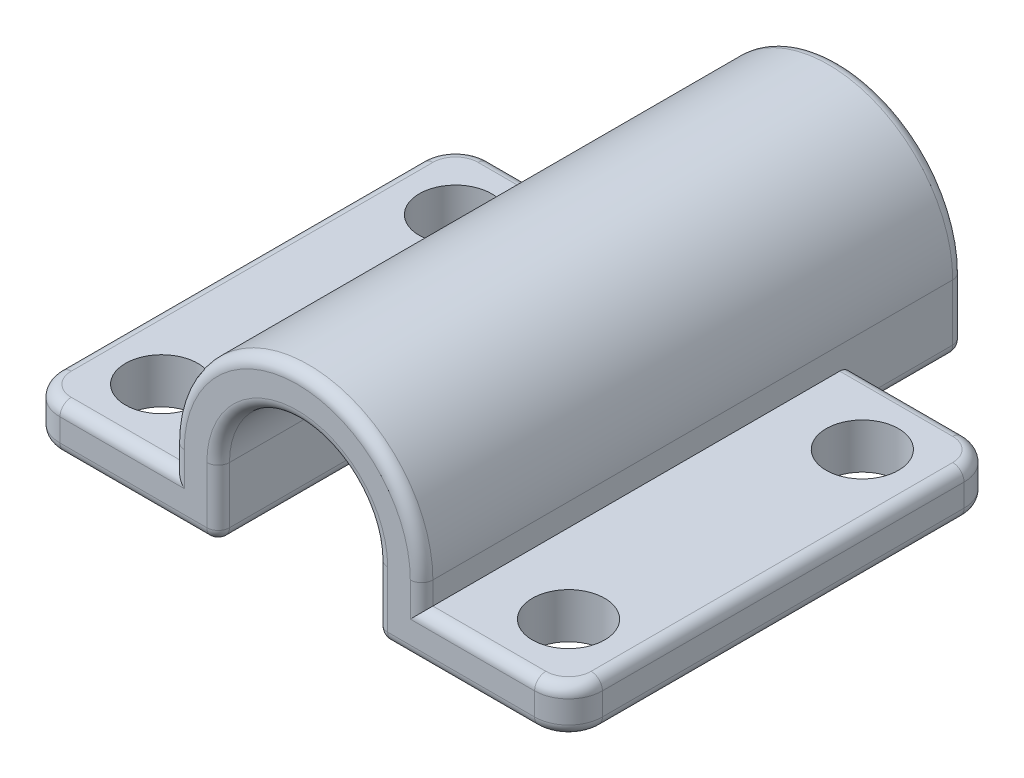
from build123d import *
from build123d.topology import SkipClean

# Parameters (mm, degrees)
BOSS_EXTRUDE1_DEPTH  = 19
M3_CLEARANCE_HOLE1_D = 3.2
BOSS_EXTRUDE2_START  = 5
BOSS_EXTRUDE2_DEPTH  = 5
M3_CLEARANCE_HOLE2_D = 3.2
FILLET1_R            = 1.5
FILLET2_R            = 0.5


with BuildPart() as part:
    # Sketch1 → Boss-Extrude1 (new body)
    with BuildSketch(Plane.XY):
        with BuildLine():
            ThreePointArc((-5.5, 0), (-5.477033779, -0.502096593), (-5.408326913, -1))
            Line((-5.408326913, -1), (-3.5, -1))
            Line((-3.5, -1), (-3.5, 0))
            ThreePointArc((-3.5, 0), (0, 3.5), (3.5, 0))
            Line((3.5, 0), (3.5, -1))
            Line((3.5, -1), (5.408326913, -1))
            ThreePointArc((5.408326913, -1), (5.477033779, -0.502096593), (5.5, 0))
            ThreePointArc((5.5, 0), (0, 5.5), (-5.5, 0))
        make_face()
        with BuildLine():
            Line((5.5, -1), (5.5, 0))
            ThreePointArc((5.5, 0), (5.477033779, -0.502096593), (5.408326913, -1))
            Line((5.408326913, -1), (5.5, -1))
        make_face()
        with BuildLine():
            Line((-5.5, 0), (-5.5, -1))
            Line((-5.5, -1), (-5.408326913, -1))
            ThreePointArc((-5.408326913, -1), (-5.477033779, -0.502096593), (-5.5, 0))
        make_face()
        with BuildLine():
            Line((-5.5, -1), (-12, -1))
            Line((-12, -1), (-12, -3))
            Line((-12, -3), (-4.609772229, -3))
            ThreePointArc((-4.609772229, -3), (-5.107893656, -2.039466204), (-5.408326913, -1))
            Line((-5.408326913, -1), (-5.5, -1))
        make_face()
        with BuildLine():
            Line((-3.5, -1), (-5.408326913, -1))
            ThreePointArc((-5.408326913, -1), (-5.107893656, -2.039466204), (-4.609772229, -3))
            Line((-4.609772229, -3), (-3.5, -3))
            Line((-3.5, -3), (-3.5, -1))
        make_face()
        with BuildLine():
            Line((3.5, -3), (4.609772229, -3))
            ThreePointArc((4.609772229, -3), (5.107893656, -2.039466204), (5.408326913, -1))
            Line((5.408326913, -1), (3.5, -1))
            Line((3.5, -1), (3.5, -3))
        make_face()
        with BuildLine():
            ThreePointArc((5.408326913, -1), (5.107893656, -2.039466204), (4.609772229, -3))
            Line((4.609772229, -3), (12, -3))
            Line((12, -3), (12, -1))
            Line((12, -1), (5.5, -1))
            Line((5.5, -1), (5.408326913, -1))
        make_face()
    extrude(amount=BOSS_EXTRUDE1_DEPTH)

    # M3 Clearance Hole1 (through all)
    with Locations(Plane(origin=(0, -1, 0), x_dir=(1, 0, 0), z_dir=(0, 1, 0))):
        with Locations((9, -3), (-9, -3)):
            Hole(M3_CLEARANCE_HOLE1_D / 2)

    # Sketch5 → Boss-Extrude2 (add)
    with SkipClean():  # the faces are left unmerged after this step: merging them gives an invalid solid
        with BuildSketch(Plane(origin=(0, 0, 0), x_dir=(-1, 0, 0), z_dir=(0, 0, -1)).offset(BOSS_EXTRUDE2_START)):
            with BuildLine():
                Line((-5.5, 0), (-5.5, -1))
                Line((-5.5, -1), (-5.5, -3))
                Line((-5.5, -3), (-3.5, -3))
                Line((-3.5, -3), (-3.5, 0))
                ThreePointArc((-3.5, 0), (0, 3.5), (3.5, 0))
                Line((3.5, 0), (3.5, -3))
                Line((3.5, -3), (5.5, -3))
                Line((5.5, -3), (5.5, -1))
                Line((5.5, -1), (5.5, 0))
                ThreePointArc((5.5, 0), (0, 5.5), (-5.5, 0))
            make_face()
        extrude(amount=-BOSS_EXTRUDE2_DEPTH)

    # M3 Clearance Hole2 (through all)
    with Locations(Plane(origin=(0, -1, 0), x_dir=(1, 0, 0), z_dir=(0, 1, 0))):
        with Locations((-9, -16), (9, -16)):
            Hole(M3_CLEARANCE_HOLE2_D / 2)

    # Fillet1
    fillet1_edges = [part.edges().sort_by_distance(p)[0] for p in [
        (12, -2, 0),
        (-12, -2, 0),
        (-12, -2, 19),
        (12, -2, 19),
    ]]
    fillet(fillet1_edges, radius=FILLET1_R)

    # Fillet2
    # the kernel refuses this fillet: 0.5 mm, written as the material it takes off along each edge
    with BuildSketch(Plane(origin=(-4, -2.5, 18.5), x_dir=(0, -1, 0), z_dir=(0, 0, 1))) as fillet2_piece_1_section:
        Polygon((0, 0), (FILLET2_R, 0), (FILLET2_R, FILLET2_R), (0, FILLET2_R), align=None)
    fillet2_piece_1 = extrude(amount=FILLET2_R, mode=Mode.PRIVATE)
    fillet2_piece_1 = fillet2_piece_1 - Plane(origin=(-4, -2.5, 18.5), x_dir=(-0.7071067811865477, 0.7071067811865475, 0), z_dir=(0, 0, 1)) * Sphere(FILLET2_R, mode=Mode.PRIVATE)
    add(fillet2_piece_1, mode=Mode.SUBTRACT)
    with BuildSketch(Plane(origin=(4, -2.5, 18.5), x_dir=(-1, 0, 0), z_dir=(0, 0, 1))) as fillet2_piece_2_section:
        Polygon((0, 0), (FILLET2_R, 0), (FILLET2_R, FILLET2_R), (0, FILLET2_R), align=None)
    fillet2_piece_2 = extrude(amount=FILLET2_R, mode=Mode.PRIVATE)
    fillet2_piece_2 = fillet2_piece_2 - Plane(origin=(4, -2.5, 18.5), x_dir=(0.7071067811865475, 0.7071067811865475, 0), z_dir=(0, 0, 1)) * Sphere(FILLET2_R, mode=Mode.PRIVATE)
    add(fillet2_piece_2, mode=Mode.SUBTRACT)
    with BuildSketch(Plane(origin=(-5, -2.5, -4.5), x_dir=(0, -1, 0), z_dir=(-1, 0, 0))) as fillet2_piece_3_section:
        Polygon((0, 0), (FILLET2_R, 0), (FILLET2_R, -FILLET2_R), (0, -FILLET2_R), align=None)
    fillet2_piece_3 = extrude(amount=FILLET2_R, mode=Mode.PRIVATE)
    fillet2_piece_3 = fillet2_piece_3 - Plane(origin=(-5, -2.5, -4.5), x_dir=(0, 0.7071067811865475, 0.7071067811865475), z_dir=(-1, 0, 0)) * Sphere(FILLET2_R, mode=Mode.PRIVATE)
    add(fillet2_piece_3, mode=Mode.SUBTRACT)
    with BuildSketch(Plane(origin=(5, -2.5, -4.5), x_dir=(1, 0, 0), z_dir=(0, 0, -1))) as fillet2_piece_4_section:
        Polygon((0, 0), (FILLET2_R, 0), (FILLET2_R, FILLET2_R), (0, FILLET2_R), align=None)
    fillet2_piece_4 = extrude(amount=FILLET2_R, mode=Mode.PRIVATE)
    fillet2_piece_4 = fillet2_piece_4 - Plane(origin=(5, -2.5, -4.5), x_dir=(-0.7071067811865475, 0.7071067811865475, 0), z_dir=(0, 0, -1)) * Sphere(FILLET2_R, mode=Mode.PRIVATE)
    add(fillet2_piece_4, mode=Mode.SUBTRACT)
    with BuildSketch(Plane(origin=(4, -2.5, -4.5), x_dir=(0, -1, 0), z_dir=(-1, 0, 0))) as fillet2_piece_5_section:
        Polygon((0, 0), (FILLET2_R, 0), (FILLET2_R, -FILLET2_R), (0, -FILLET2_R), align=None)
    fillet2_piece_5 = extrude(amount=FILLET2_R, mode=Mode.PRIVATE)
    fillet2_piece_5 = fillet2_piece_5 - Plane(origin=(4, -2.5, -4.5), x_dir=(0, 0.7071067811865475, 0.7071067811865475), z_dir=(-1, 0, 0)) * Sphere(FILLET2_R, mode=Mode.PRIVATE)
    add(fillet2_piece_5, mode=Mode.SUBTRACT)
    with BuildSketch(Plane(origin=(-4, -2.5, -4.5), x_dir=(1, 0, 0), z_dir=(0, -1, 0))) as fillet2_piece_6_section:
        Polygon((0, 0), (FILLET2_R, 0), (FILLET2_R, -FILLET2_R), (0, -FILLET2_R), align=None)
    fillet2_piece_6 = extrude(amount=FILLET2_R, mode=Mode.PRIVATE)
    fillet2_piece_6 = fillet2_piece_6 - Plane(origin=(-4, -2.5, -4.5), x_dir=(-0.7071067811865475, 0, 0.7071067811865475), z_dir=(0, -1, 0)) * Sphere(FILLET2_R, mode=Mode.PRIVATE)
    add(fillet2_piece_6, mode=Mode.SUBTRACT)
    with BuildSketch(Plane(origin=(12, -1, 1.5), x_dir=(-1, 0, 0), z_dir=(0, 0, 1)), Plane(origin=(-12, -3, 1.5), x_dir=(1, 0, 0), z_dir=(0, 0, 1))) as fillet2_piece_7:
        with BuildLine():
            CenterArc((FILLET2_R, FILLET2_R), FILLET2_R, 180, 90)
            Line((0, FILLET2_R), (0, 0))
            Line((0, 0), (FILLET2_R, 0))
        make_face()
    extrude(amount=16, mode=Mode.SUBTRACT)
    with BuildSketch(Plane(origin=(12, -3, 1.5), x_dir=(-1, 0, 0), z_dir=(0, 0, 1)), Plane(origin=(-12, -1, 1.5), x_dir=(1, 0, 0), z_dir=(0, 0, 1))) as fillet2_piece_8:
        with BuildLine():
            CenterArc((FILLET2_R, -FILLET2_R), FILLET2_R, 90, 90)
            Line((0, -FILLET2_R), (0, 0))
            Line((0, 0), (FILLET2_R, 0))
        make_face()
    extrude(amount=16, mode=Mode.SUBTRACT)
    with BuildSketch(Plane(origin=(10.5, -3, 1.5), x_dir=(1, 0, 0), z_dir=(0, 0, 1))) as fillet2_piece_9:
        with BuildLine():
            CenterArc((1.5 - FILLET2_R, FILLET2_R), FILLET2_R, 270, 90)
            Line((1.5, FILLET2_R), (1.5, 0))
            Line((1.5, 0), (1.5 - FILLET2_R, 0))
        make_face()
    revolve(axis=Axis((10.5, -3, 1.5), (0, 1, 0)), revolution_arc=90, mode=Mode.SUBTRACT)
    with BuildSketch(Plane(origin=(10.5, -3, 17.5), x_dir=(0, 0, 1), z_dir=(-1, 0, 0))) as fillet2_piece_10:
        with BuildLine():
            CenterArc((1.5 - FILLET2_R, FILLET2_R), FILLET2_R, 270, 90)
            Line((1.5 - FILLET2_R, 0), (1.5, 0))
            Line((1.5, 0), (1.5, FILLET2_R))
        make_face()
    revolve(axis=Axis((10.5, -3, 17.5), (0, 1, 0)), revolution_arc=90, mode=Mode.SUBTRACT)
    with BuildSketch(Plane(origin=(-10.5, -1, 19), x_dir=(0, -1, 0), z_dir=(1, 0, 0)), Plane(origin=(-5.5, -3, 0), x_dir=(0, 0, 1), z_dir=(-1, 0, 0)), Plane(origin=(5.5, -1, 19), x_dir=(0, -1, 0), z_dir=(1, 0, 0)), Plane(origin=(10.5, -3, 0), x_dir=(0, 0, 1), z_dir=(-1, 0, 0))) as fillet2_piece_11:
        with BuildLine():
            CenterArc((FILLET2_R, FILLET2_R), FILLET2_R, 180, 90)
            Line((0, FILLET2_R), (0, 0))
            Line((0, 0), (FILLET2_R, 0))
        make_face()
    extrude(amount=5, mode=Mode.SUBTRACT)
    with BuildSketch(Plane(origin=(-10.5, -3, 19), x_dir=(0, 1, 0), z_dir=(1, 0, 0)), Plane(origin=(4, -3, 19), x_dir=(0, 1, 0), z_dir=(1, 0, 0))) as fillet2_piece_12:
        with BuildLine():
            CenterArc((FILLET2_R, -FILLET2_R), FILLET2_R, 90, 90)
            Line((0, -FILLET2_R), (0, 0))
            Line((0, 0), (FILLET2_R, 0))
        make_face()
    extrude(amount=6.5, mode=Mode.SUBTRACT)
    with BuildSketch(Plane(origin=(5.5, -1, 19), x_dir=(-1, 0, 0), z_dir=(0, 1, 0)), Plane(origin=(-5.5, 0, 19), x_dir=(1, 0, 0), z_dir=(0, -1, 0))) as fillet2_piece_13:
        with BuildLine():
            CenterArc((FILLET2_R, -FILLET2_R), FILLET2_R, 90, 90)
            Line((0, -FILLET2_R), (0, 0))
            Line((0, 0), (FILLET2_R, 0))
        make_face()
    extrude(amount=1, mode=Mode.SUBTRACT)
    with BuildSketch(Plane(origin=(10.5, -1, 1.5), x_dir=(1, 0, 0), z_dir=(0, 0, 1))) as fillet2_piece_14:
        with BuildLine():
            CenterArc((1.5 - FILLET2_R, -FILLET2_R), FILLET2_R, 0, 90)
            Line((1.5, -FILLET2_R), (1.5, 0))
            Line((1.5, 0), (1.5 - FILLET2_R, 0))
        make_face()
    revolve(axis=Axis((10.5, -1, 1.5), (0, 1, 0)), revolution_arc=90, mode=Mode.SUBTRACT)
    with BuildSketch(Plane(origin=(10.5, -1, 17.5), x_dir=(0, 0, 1), z_dir=(-1, 0, 0))) as fillet2_piece_15:
        with BuildLine():
            CenterArc((1.5 - FILLET2_R, -FILLET2_R), FILLET2_R, 0, 90)
            Line((1.5, -FILLET2_R), (1.5, 0))
            Line((1.5, 0), (1.5 - FILLET2_R, 0))
        make_face()
    revolve(axis=Axis((10.5, -1, 17.5), (0, 1, 0)), revolution_arc=90, mode=Mode.SUBTRACT)
    with BuildSketch(Plane(origin=(-10.5, -3, 17.5), x_dir=(0, 0, 1), z_dir=(1, 0, 0))) as fillet2_piece_16:
        with BuildLine():
            CenterArc((1.5 - FILLET2_R, -FILLET2_R), FILLET2_R, 0, 90)
            Line((1.5 - FILLET2_R, 0), (1.5, 0))
            Line((1.5, 0), (1.5, -FILLET2_R))
        make_face()
    revolve(axis=Axis((-10.5, -3, 17.5), (0, -1, 0)), revolution_arc=90, mode=Mode.SUBTRACT)
    with BuildSketch(Plane(origin=(-10.5, -3, 1.5), x_dir=(-1, 0, 0), z_dir=(0, 0, 1))) as fillet2_piece_17:
        with BuildLine():
            CenterArc((1.5 - FILLET2_R, -FILLET2_R), FILLET2_R, 0, 90)
            Line((1.5, -FILLET2_R), (1.5, 0))
            Line((1.5, 0), (1.5 - FILLET2_R, 0))
        make_face()
    revolve(axis=Axis((-10.5, -3, 1.5), (0, -1, 0)), revolution_arc=90, mode=Mode.SUBTRACT)
    with BuildSketch(Plane(origin=(-5.5, -1, 0), x_dir=(0, 0, 1), z_dir=(-1, 0, 0)), Plane(origin=(10.5, -1, 0), x_dir=(0, 0, 1), z_dir=(-1, 0, 0))) as fillet2_piece_18:
        with BuildLine():
            CenterArc((FILLET2_R, -FILLET2_R), FILLET2_R, 90, 90)
            Line((0, -FILLET2_R), (0, 0))
            Line((0, 0), (FILLET2_R, 0))
        make_face()
    extrude(amount=5, mode=Mode.SUBTRACT)
    with BuildSketch(Plane(origin=(-10.5, -1, 17.5), x_dir=(0, 0, 1), z_dir=(1, 0, 0))) as fillet2_piece_19:
        with BuildLine():
            CenterArc((1.5 - FILLET2_R, FILLET2_R), FILLET2_R, 270, 90)
            Line((1.5, FILLET2_R), (1.5, 0))
            Line((1.5, 0), (1.5 - FILLET2_R, 0))
        make_face()
    revolve(axis=Axis((-10.5, -1, 17.5), (0, -1, 0)), revolution_arc=90, mode=Mode.SUBTRACT)
    with BuildSketch(Plane(origin=(-10.5, -1, 1.5), x_dir=(-1, 0, 0), z_dir=(0, 0, 1))) as fillet2_piece_20:
        with BuildLine():
            CenterArc((1.5 - FILLET2_R, FILLET2_R), FILLET2_R, 270, 90)
            Line((1.5, FILLET2_R), (1.5, 0))
            Line((1.5, 0), (1.5 - FILLET2_R, 0))
        make_face()
    revolve(axis=Axis((-10.5, -1, 1.5), (0, -1, 0)), revolution_arc=90, mode=Mode.SUBTRACT)
    with BuildSketch(Plane(origin=(0, 0, 19), x_dir=(-1, 0, 0), z_dir=(0, -1, 0))) as fillet2_piece_21:
        with BuildLine():
            CenterArc((5.5 - FILLET2_R, FILLET2_R), FILLET2_R, 270, 90)
            Line((5.5, FILLET2_R), (5.5, 0))
            Line((5.5, 0), (5.5 - FILLET2_R, 0))
        make_face()
    revolve(axis=Axis((0, 0, 19), (0, 0, -1)), revolution_arc=180, mode=Mode.SUBTRACT)
    with BuildSketch(Plane(origin=(3.5, -3, 0), x_dir=(0, 1, 0), z_dir=(0, 0, 1)), Plane(origin=(-3.5, -3, 0), x_dir=(-1, 0, 0), z_dir=(0, 0, 1))) as fillet2_piece_22:
        with BuildLine():
            CenterArc((FILLET2_R, -FILLET2_R), FILLET2_R, 90, 90)
            Line((0, -FILLET2_R), (0, 0))
            Line((0, 0), (FILLET2_R, 0))
        make_face()
    extrude(amount=18.5, mode=Mode.SUBTRACT)
    with BuildSketch(Plane(origin=(-3.5, -2.5, 19), x_dir=(-1, 0, 0), z_dir=(0, 1, 0)), Plane(origin=(-5.5, 0, -5), x_dir=(0, 0, 1), z_dir=(0, -1, 0)), Plane(origin=(3.5, 0, 19), x_dir=(1, 0, 0), z_dir=(0, -1, 0)), Plane(origin=(5.5, -2.5, -5), x_dir=(0, 0, 1), z_dir=(0, 1, 0))) as fillet2_piece_23:
        with BuildLine():
            CenterArc((FILLET2_R, -FILLET2_R), FILLET2_R, 90, 90)
            Line((0, -FILLET2_R), (0, 0))
            Line((0, 0), (FILLET2_R, 0))
        make_face()
    extrude(amount=2.5, mode=Mode.SUBTRACT)
    with BuildSketch(Plane(origin=(0, 0, 19), x_dir=(-1, 0, 0), z_dir=(0, -1, 0))) as fillet2_piece_24:
        with BuildLine():
            CenterArc((3.5 + FILLET2_R, FILLET2_R), FILLET2_R, 180, 90)
            Line((3.5, FILLET2_R), (3.5, 0))
            Line((3.5, 0), (3.5 + FILLET2_R, 0))
        make_face()
    revolve(axis=Axis((0, 0, 19), (0, 0, -1)), revolution_arc=180, mode=Mode.SUBTRACT)
    with BuildSketch(Plane(origin=(-5.5, -3, -4.5), x_dir=(0, 1, 0), z_dir=(0, 0, 1)), Plane(origin=(-3.5, -3, -4.5), x_dir=(-1, 0, 0), z_dir=(0, 0, 1)), Plane(origin=(3.5, -3, -4.5), x_dir=(0, 1, 0), z_dir=(0, 0, 1))) as fillet2_piece_25:
        with BuildLine():
            CenterArc((FILLET2_R, -FILLET2_R), FILLET2_R, 90, 90)
            Line((0, -FILLET2_R), (0, 0))
            Line((0, 0), (FILLET2_R, 0))
        make_face()
    extrude(amount=4.5, mode=Mode.SUBTRACT)
    with BuildSketch(Plane(origin=(5.5, -3, -4.5), x_dir=(0, 1, 0), z_dir=(0, 0, 1))) as fillet2_piece_26:
        with BuildLine():
            CenterArc((FILLET2_R, FILLET2_R), FILLET2_R, 180, 90)
            Line((0, FILLET2_R), (0, 0))
            Line((0, 0), (FILLET2_R, 0))
        make_face()
    extrude(amount=4.5, mode=Mode.SUBTRACT)
    with BuildSketch(Plane(origin=(0, 0, -5), x_dir=(-1, 0, 0), z_dir=(0, -1, 0))) as fillet2_piece_27:
        with BuildLine():
            CenterArc((5.5 - FILLET2_R, -FILLET2_R), FILLET2_R, 0, 90)
            Line((5.5 - FILLET2_R, 0), (5.5, 0))
            Line((5.5, 0), (5.5, -FILLET2_R))
        make_face()
    revolve(axis=Axis((0, 0, -5), (0, 0, -1)), revolution_arc=180, mode=Mode.SUBTRACT)
    with BuildSketch(Plane(origin=(5, -3, -5), x_dir=(0, 0, 1), z_dir=(-1, 0, 0)), Plane(origin=(-4, -3, -5), x_dir=(0, 0, 1), z_dir=(-1, 0, 0))) as fillet2_piece_28:
        with BuildLine():
            CenterArc((FILLET2_R, FILLET2_R), FILLET2_R, 180, 90)
            Line((0, FILLET2_R), (0, 0))
            Line((0, 0), (FILLET2_R, 0))
        make_face()
    extrude(amount=1, mode=Mode.SUBTRACT)
    with BuildSketch(Plane(origin=(3.5, -2.5, -5), x_dir=(0, 0, 1), z_dir=(0, 1, 0)), Plane(origin=(-3.5, 0, -5), x_dir=(0, 0, 1), z_dir=(0, -1, 0))) as fillet2_piece_29:
        with BuildLine():
            CenterArc((FILLET2_R, FILLET2_R), FILLET2_R, 180, 90)
            Line((0, FILLET2_R), (0, 0))
            Line((0, 0), (FILLET2_R, 0))
        make_face()
    extrude(amount=2.5, mode=Mode.SUBTRACT)
    with BuildSketch(Plane(origin=(0, 0, -5), x_dir=(1, 0, 0), z_dir=(0, -1, 0))) as fillet2_piece_30:
        with BuildLine():
            CenterArc((3.5 + FILLET2_R, FILLET2_R), FILLET2_R, 180, 90)
            Line((3.5 + FILLET2_R, 0), (3.5, 0))
            Line((3.5, 0), (3.5, FILLET2_R))
        make_face()
    revolve(axis=Axis((0, 0, -5), (0, 0, 1)), revolution_arc=180, mode=Mode.SUBTRACT)
    with BuildSketch(Plane(origin=(-10.5, -1, 19), x_dir=(0, -1, 0), z_dir=(1, 0, 0))) as fillet2_piece_31a_section:
        with BuildLine():
            CenterArc((FILLET2_R, FILLET2_R), FILLET2_R, 180, 90)
            Line((0, FILLET2_R), (0, 0))
            Line((0, 0), (FILLET2_R, 0))
        make_face()
    fillet2_piece_31a = extrude(amount=6.25, mode=Mode.PRIVATE)
    fillet2_piece_31a = split(fillet2_piece_31a, bisect_by=Plane(origin=(-5.5, -1.113197557, 18.886802443), z_dir=(1, 0, 0)), keep=Keep.TOP, mode=Mode.PRIVATE)
    with BuildSketch(Plane(origin=(-5.5, 0, 19), x_dir=(1, 0, 0), z_dir=(0, -1, 0))) as fillet2_piece_31b_section:
        with BuildLine():
            CenterArc((FILLET2_R, -FILLET2_R), FILLET2_R, 90, 90)
            Line((0, -FILLET2_R), (0, 0))
            Line((0, 0), (FILLET2_R, 0))
        make_face()
    fillet2_piece_31b = extrude(amount=2.25, mode=Mode.PRIVATE)
    fillet2_piece_31b = split(fillet2_piece_31b, bisect_by=Plane(origin=(-5.386802443, -1, 18.886802443), z_dir=(0, -1, 0)), keep=Keep.TOP, mode=Mode.PRIVATE)
    fillet2_piece_31 = fillet2_piece_31a & fillet2_piece_31b
    add(fillet2_piece_31, mode=Mode.SUBTRACT)
    with BuildSketch(Plane(origin=(5.5, -2.25, 19), x_dir=(-1, 0, 0), z_dir=(0, 1, 0))) as fillet2_piece_32a_section:
        with BuildLine():
            CenterArc((FILLET2_R, -FILLET2_R), FILLET2_R, 90, 90)
            Line((0, -FILLET2_R), (0, 0))
            Line((0, 0), (FILLET2_R, 0))
        make_face()
    fillet2_piece_32a = extrude(amount=2.25, mode=Mode.PRIVATE)
    fillet2_piece_32a = split(fillet2_piece_32a, bisect_by=Plane(origin=(5.386802443, -1, 18.886802443), z_dir=(0, -1, 0)), keep=Keep.TOP, mode=Mode.PRIVATE)
    with BuildSketch(Plane(origin=(4.25, -1, 19), x_dir=(0, -1, 0), z_dir=(1, 0, 0))) as fillet2_piece_32b_section:
        with BuildLine():
            CenterArc((FILLET2_R, FILLET2_R), FILLET2_R, 180, 90)
            Line((0, FILLET2_R), (0, 0))
            Line((0, 0), (FILLET2_R, 0))
        make_face()
    fillet2_piece_32b = extrude(amount=6.25, mode=Mode.PRIVATE)
    fillet2_piece_32b = split(fillet2_piece_32b, bisect_by=Plane(origin=(5.5, -1.113197557, 18.886802443), z_dir=(-1, 0, 0)), keep=Keep.TOP, mode=Mode.PRIVATE)
    fillet2_piece_32 = fillet2_piece_32a & fillet2_piece_32b
    add(fillet2_piece_32, mode=Mode.SUBTRACT)
    with BuildSketch(Plane(origin=(-4.25, -3, 0), x_dir=(0, 0, 1), z_dir=(-1, 0, 0))) as fillet2_piece_33a_section:
        with BuildLine():
            CenterArc((FILLET2_R, FILLET2_R), FILLET2_R, 180, 90)
            Line((0, FILLET2_R), (0, 0))
            Line((0, 0), (FILLET2_R, 0))
        make_face()
    fillet2_piece_33a = extrude(amount=6.25, mode=Mode.PRIVATE)
    fillet2_piece_33a = split(fillet2_piece_33a, bisect_by=Plane(origin=(-5.5, -2.886802443, 0.113197557), z_dir=(1, 0, 0)), keep=Keep.TOP, mode=Mode.PRIVATE)
    with BuildSketch(Plane(origin=(-5.5, -3, -4.5), x_dir=(0, 1, 0), z_dir=(0, 0, 1))) as fillet2_piece_33b_section:
        with BuildLine():
            CenterArc((FILLET2_R, -FILLET2_R), FILLET2_R, 90, 90)
            Line((0, -FILLET2_R), (0, 0))
            Line((0, 0), (FILLET2_R, 0))
        make_face()
    fillet2_piece_33b = extrude(amount=5.75, mode=Mode.PRIVATE)
    fillet2_piece_33b = split(fillet2_piece_33b, bisect_by=Plane(origin=(-5.386802443, -2.886802443, 0), z_dir=(0, 0, 1)), keep=Keep.TOP, mode=Mode.PRIVATE)
    fillet2_piece_33 = fillet2_piece_33a & fillet2_piece_33b
    add(fillet2_piece_33, mode=Mode.SUBTRACT)
    with BuildSketch(Plane(origin=(10.5, -3, 0), x_dir=(0, 0, 1), z_dir=(-1, 0, 0))) as fillet2_piece_34a_section:
        with BuildLine():
            CenterArc((FILLET2_R, FILLET2_R), FILLET2_R, 180, 90)
            Line((0, FILLET2_R), (0, 0))
            Line((0, 0), (FILLET2_R, 0))
        make_face()
    fillet2_piece_34a = extrude(amount=6.25, mode=Mode.PRIVATE)
    fillet2_piece_34a = split(fillet2_piece_34a, bisect_by=Plane(origin=(5.5, -2.886802443, 0.113197557), z_dir=(-1, 0, 0)), keep=Keep.TOP, mode=Mode.PRIVATE)
    with BuildSketch(Plane(origin=(5.5, -3, -4.5), x_dir=(0, 1, 0), z_dir=(0, 0, 1))) as fillet2_piece_34b_section:
        with BuildLine():
            CenterArc((FILLET2_R, FILLET2_R), FILLET2_R, 180, 90)
            Line((0, FILLET2_R), (0, 0))
            Line((0, 0), (FILLET2_R, 0))
        make_face()
    fillet2_piece_34b = extrude(amount=5.75, mode=Mode.PRIVATE)
    fillet2_piece_34b = split(fillet2_piece_34b, bisect_by=Plane(origin=(5.386802443, -2.886802443, 0), z_dir=(0, 0, 1)), keep=Keep.TOP, mode=Mode.PRIVATE)
    fillet2_piece_34 = fillet2_piece_34a & fillet2_piece_34b
    add(fillet2_piece_34, mode=Mode.SUBTRACT)


solid = part.part
